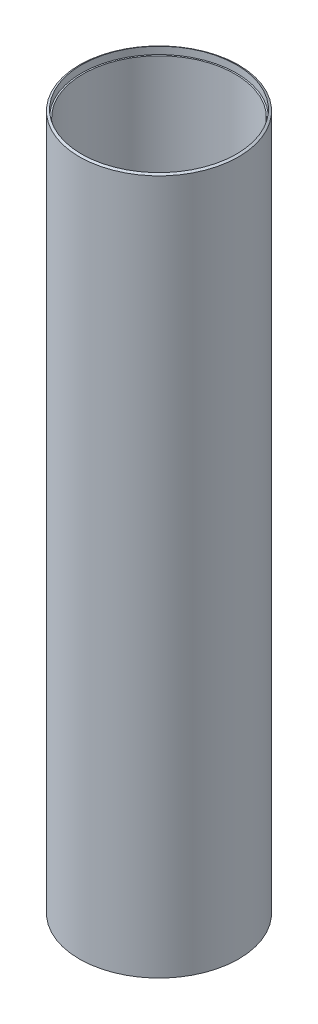
from build123d import *


with BuildPart() as part:
    # Sketch2 → Revolve1 (revolve)
    with BuildSketch(Plane.XY):
        Polygon((-69.85, 1.099852263), (-69.85, 610.699852263), (-67.945, 611.799704526), (-67.945, 605.449704526), (-66.675, 605.449704526), (-66.675, 6.35), (-67.945, 6.35), (-67.945, 0), align=None)
    revolve(axis=Axis((0, 819.187021794, 0), (0, -1, 0)))


solid = part.part
